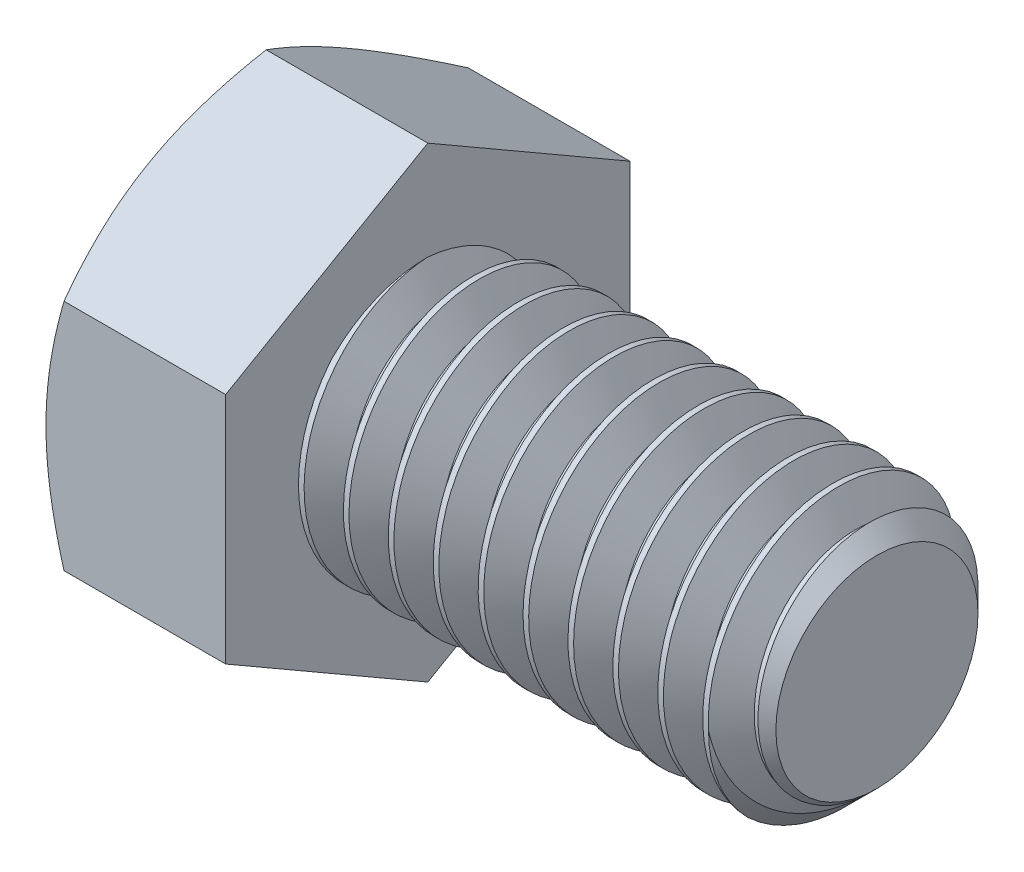
from build123d import *

# Parameters (mm, degrees)
SKETCH5_R           = 4.7625
BOSS_EXTRUDE3_DEPTH = 15.875
CHAMFER1_SIZE       = 1.190625
CUT_SWEEP1_PITCH    = 1.5875
BOSS_EXTRUDE4_DEPTH = 6.35
SKETCH8_OUTSIDE_W   = 111.75
SKETCH8_OUTSIDE_H   = 113.96
SKETCH8_OUTSIDE_R   = 7.14375
CUT_EXTRUDE3_DEPTH  = 25.759402564
CUT_EXTRUDE3_DRAFT  = -60


with BuildPart() as part:
    # Sketch5 → Boss-Extrude3 (new body)
    with BuildSketch(Plane(origin=(11.1125, 0, 0), x_dir=(0, 0, -1), z_dir=(1, 0, 0))):
        Circle(SKETCH5_R)
    extrude(amount=-BOSS_EXTRUDE3_DEPTH)

    # Chamfer1
    chamfer1_edges = [part.edges().sort_by_distance(p)[0] for p in [
        (11.1125, 0, 4.7625),
    ]]
    chamfer(chamfer1_edges, length=CHAMFER1_SIZE)

    # Cut-Sweep1: arcs per turn and ends read off the stored shape
    # Cut-Sweep1: the profile of Sketch10 profile screwed along a right-hand helix through 11 turns, 8 arcs to a turn; built about Z, then put on its axis
    cut_sweep1_z = Axis((0, 0, 0), (0, 0, 1))
    cut_sweep1_corners = [(4.7628, 0, 0.000173205), (3.731388504, 0, -0.5953125), (3.731388504, 0, -0.79375), (4.7628, 0, -1.389235705)]
    with BuildLine(mode=Mode.PRIVATE) as cut_sweep1_profile:
        Line(cut_sweep1_corners[0], cut_sweep1_corners[1])
        Line(cut_sweep1_corners[1], cut_sweep1_corners[2])
        Line(cut_sweep1_corners[2], cut_sweep1_corners[3])
        Line(cut_sweep1_corners[3], cut_sweep1_corners[0])
    cut_sweep1_cap = Face(cut_sweep1_profile.wire())
    cut_sweep1_turn_angles = [0, 22.5, 45, 67.5, 90, 112.5, 135, 157.5, 180, 202.5, 225, 247.5, 270, 292.5, 315, 337.5, 360]
    cut_sweep1_turn_weights = [1, 0.9238795325112867, 1, 0.9238795325112867, 1, 0.9238795325112867, 1, 0.9238795325112867, 1, 0.9238795325112867, 1, 0.9238795325112867, 1, 0.9238795325112867, 1, 0.9238795325112867, 1]
    cut_sweep1_turn_rails = [Edge.make_bspline([Vector(p[0], p[1], 0).rotate(cut_sweep1_z, cut_sweep1_turn_angles[k]) / cut_sweep1_turn_weights[k] + Vector(0, 0, p[2] + CUT_SWEEP1_PITCH * cut_sweep1_turn_angles[k] / 360) for k in range(17)], [0, 0, 0, 1, 1, 2, 2, 3, 3, 4, 4, 5, 5, 6, 6, 7, 7, 8, 8, 8], 2, cut_sweep1_turn_weights) for p in cut_sweep1_corners]
    cut_sweep1_turn_sides = [Face.make_surface_from_curves(cut_sweep1_turn_rails[p[0]], cut_sweep1_turn_rails[p[1]]) for p in [(0, 1), (1, 2), (2, 3), (3, 0)]]
    cut_sweep1 = Plane(origin=(11.1125, 0, 0), x_dir=(0, 1, 0), z_dir=(-1, 0, 0)) * Solid(Shell([*[p.moved(Location((0, 0, CUT_SWEEP1_PITCH * i))) for i in range(11) for p in cut_sweep1_turn_sides], cut_sweep1_cap, cut_sweep1_cap.rotate(cut_sweep1_z, 3960).moved(Location((0, 0, CUT_SWEEP1_PITCH * 3960 / 360)))]))
    add(cut_sweep1, mode=Mode.SUBTRACT)

    # Sketch6 → Boss-Extrude4 (add)
    with BuildSketch(Plane.ZY.offset(4.7625)):
        Polygon((7.14375, 4.124445986), (0, 8.248891971), (-7.14375, 4.124445986), (-7.14375, -4.124445986), (0, -8.248891971), (7.14375, -4.124445986), align=None)
    extrude(amount=BOSS_EXTRUDE4_DEPTH)


with BuildPart() as cut_extrude3_tool:
    # Sketch8 outside → Cut-Extrude3 (with draft: the straight prism first)
    with BuildSketch(Plane.ZY.offset(11.1125)):
        Rectangle(SKETCH8_OUTSIDE_W, SKETCH8_OUTSIDE_H)
        Circle(SKETCH8_OUTSIDE_R, mode=Mode.SUBTRACT)
    extrude(amount=-CUT_EXTRUDE3_DEPTH)
    # Cut-Extrude3: the draft: its side faces are tilted about the plane it starts from
    cut_extrude3_sides = [cut_extrude3_tool.faces().sort_by_distance(p)[0] for p in [
        (1.767201282, -56.98, 0),
        (1.767201282, 0, 55.875),
        (1.767201282, 56.98, 0),
        (1.767201282, 0, -55.875),
        (1.767201282, 0, -7.14375),
    ]]
    draft(cut_extrude3_sides, Plane.ZY.offset(11.1125), CUT_EXTRUDE3_DRAFT)


with BuildPart() as part_1:
    add(part.part)

    # Cut-Extrude3: cut by cut_extrude3_tool
    add(cut_extrude3_tool.part, mode=Mode.SUBTRACT)


solid = part_1.part
